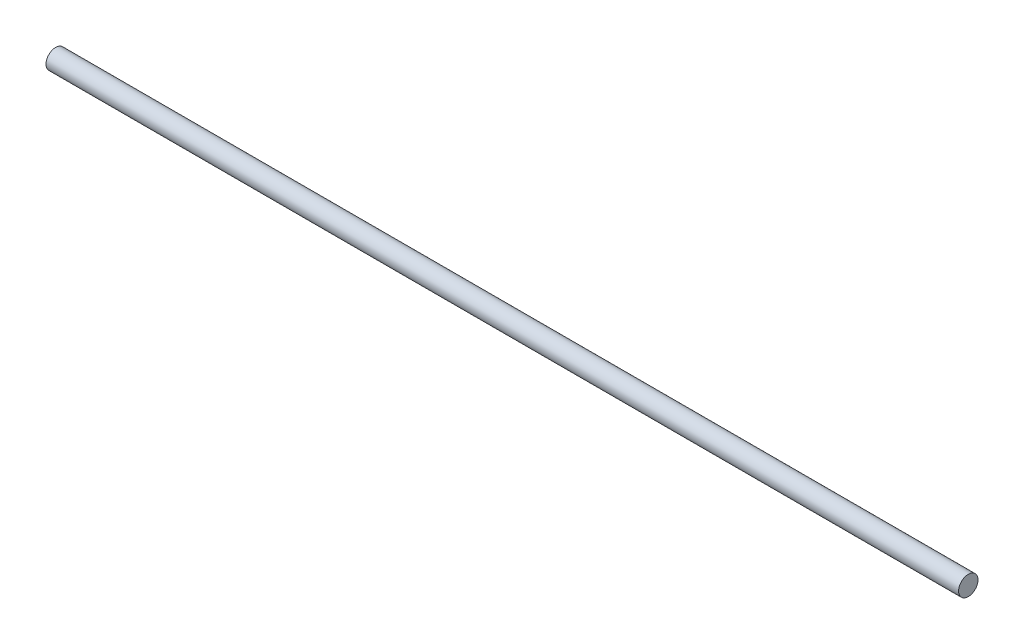
from build123d import *

# Parameters (mm, degrees)
SKETCH1_R           = 3.175
BOSS_EXTRUDE1_DEPTH = 298.45


with BuildPart() as part:
    # Sketch1 → Boss-Extrude1 (new body)
    with BuildSketch(Plane(origin=(0, 0, 0), x_dir=(0, 0, -1), z_dir=(1, 0, 0))):
        Circle(SKETCH1_R)
    extrude(amount=BOSS_EXTRUDE1_DEPTH)


solid = part.part
